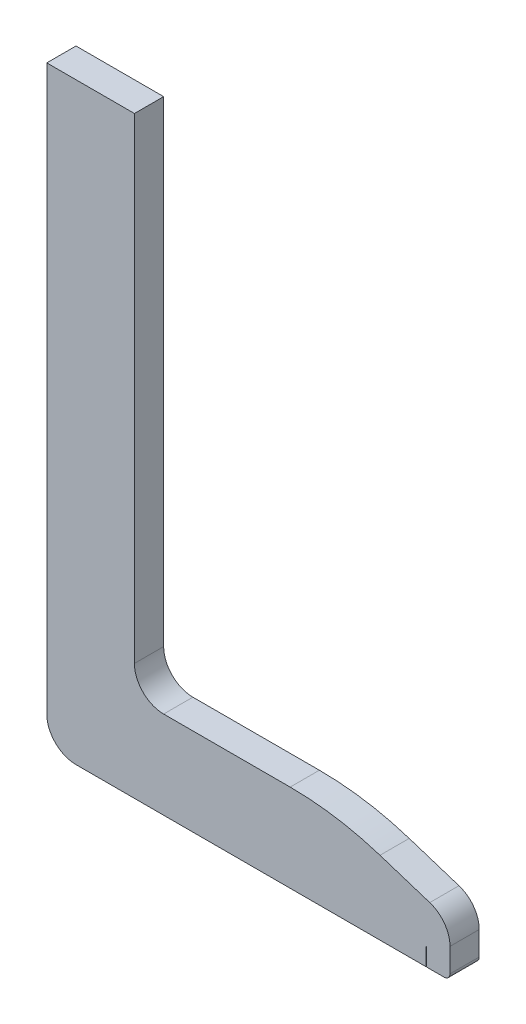
from build123d import *

# Parameters (mm, degrees)
BOSS_EXTRUDE1_DEPTH = 5
SKETCH2_W           = 0.1
SKETCH2_H           = 5
CUT_EXTRUDE2_DEPTH  = 3


with BuildPart() as part:
    # Sketch1 → Boss-Extrude1 (new body)
    with BuildSketch(Plane.XY):
        with BuildLine():
            Line((0, -1), (0, -96.5))
            ThreePointArc((0, -96.5), (1.464466094, -100.035533906), (5, -101.5))
            Line((5, -101.5), (68, -101.5))
            ThreePointArc((68, -101.5), (68.707106781, -101.207106781), (69, -100.5))
            Line((69, -100.5), (69, -96.429996046))
            ThreePointArc((69, -96.429996046), (68.042547906, -93.487580979), (65.53687743, -91.672054499))
            Line((65.53687743, -91.672054499), (57.01873992, -88.920584529))
            ThreePointArc((57.01873992, -88.920584529), (49.429079532, -87.108853154), (41.649965621, -86.5))
            Line((41.649965621, -86.5), (20, -86.5))
            ThreePointArc((20, -86.5), (16.464466094, -85.035533906), (15, -81.5))
            Line((15, -81.5), (15, -1))
            Line((15, -1), (15, 0))
            Line((15, 0), (14, 0))
            Line((14, 0), (1, 0))
            Line((1, 0), (0, 0))
            Line((0, 0), (0, -1))
        make_face()
    extrude(amount=BOSS_EXTRUDE1_DEPTH)

    # Sketch2 → Cut-Extrude2 (cut)
    with BuildSketch(Plane.XZ.offset(101.5)):
        with Locations((64.9, 2.5)):
            Rectangle(SKETCH2_W, SKETCH2_H)
    extrude(amount=-CUT_EXTRUDE2_DEPTH, mode=Mode.SUBTRACT)


solid = part.part
